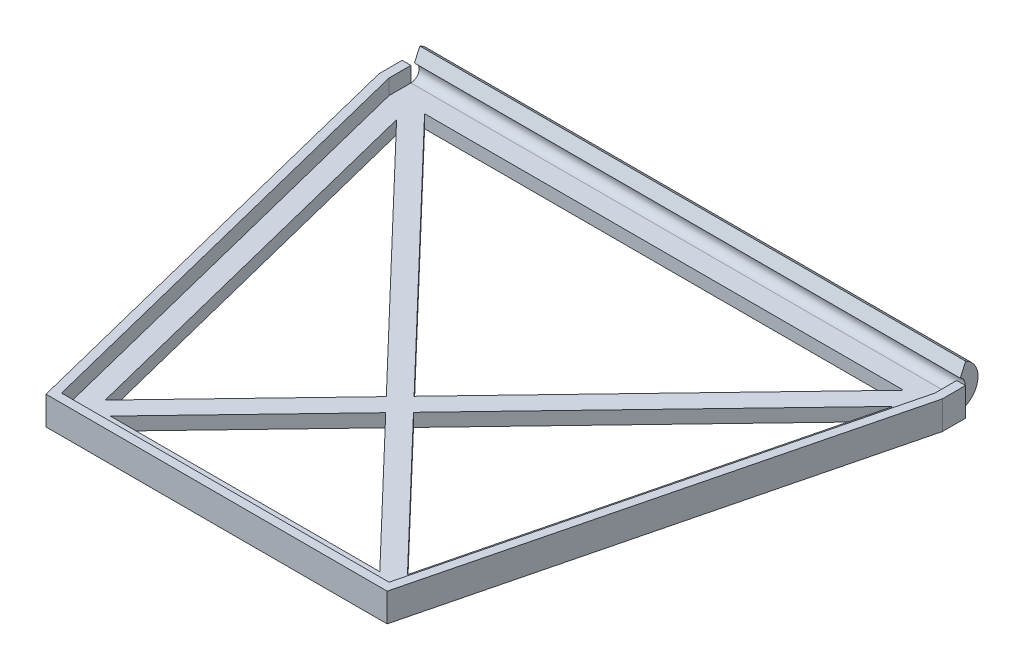
from build123d import *

# Parameters (mm, degrees)
EXTRUDE_THIN1_DEPTH = 1.2
EXTRUDE_THIN2_DEPTH = 1.2
BOSS_EXTRUDE1_DEPTH = 50.02
EXTRUDE_THIN5_START = -2.6
EXTRUDE_THIN5_DEPTH = 2.6


# Read off the part's stored shape, not the designer's step: Extrude-Thin1
with BuildPart() as part:
    # Extrude-Thin1 outline → Extrude-Thin1 (new body)
    with BuildSketch(Plane(origin=(0, 0, 0), x_dir=(1, 0, 0), z_dir=(0, 1, 0))):
        Polygon((-25.01, 39.998768944), (-15.007807764, -0.01), (15.007807764, -0.01), (25.01, 39.998768944), (25.01, 42.01), (-25.01, 42.01), align=None)
        Polygon((13.594602468, 1.8), (-13.594602468, 1.8), (-23.194602468, 40.2), (23.194602468, 40.2), align=None, mode=Mode.SUBTRACT)
    extrude(amount=EXTRUDE_THIN1_DEPTH)

    # Sketch3 → Extrude-Thin2 (add)
    with BuildSketch(Plane.XZ):
        Polygon((23.844483111, -39.577380413), (-12.944721826, -1.177380413), (-14.244483111, -2.422619587), (22.544721826, -40.822619587), align=None)
        Polygon((-22.544721826, -40.822619587), (14.244483111, -2.422619587), (12.944721826, -1.177380413), (-23.844483111, -39.577380413), align=None)
    extrude(amount=-EXTRUDE_THIN2_DEPTH)

    # Sketch4 → Boss-Extrude1 (add)
    with BuildSketch(Plane.ZY.offset(25.01)):
        with BuildLine():
            Line((-42.326963696, 2.62973084), (-42.83410561, 3.717300185))
            ThreePointArc((-42.83410561, 3.717300185), (-43.913777214, 1.527942753), (-42.01, 0))
            Line((-42.01, 0), (-42.01, 1.2))
            ThreePointArc((-42.01, 1.2), (-42.742222005, 1.78767029), (-42.326963696, 2.62973084))
        make_face()
    extrude(amount=-BOSS_EXTRUDE1_DEPTH)

    # Sketch5 → Extrude-Thin5 (add)
    with BuildSketch(Plane.XZ.offset(EXTRUDE_THIN5_START)):
        Polygon((25.01, -42.01), (25.01, -39.998768944), (15.007807764, 0.01), (-15.007807764, 0.01), (-25.01, -39.998768944), (-25.01, -42.01), (-25.81, -42.01), (-25.81, -39.900284443), (-15.632428889, 0.81), (15.632428889, 0.81), (25.81, -39.900284443), (25.81, -42.01), align=None)
    extrude(amount=EXTRUDE_THIN5_DEPTH)


solid = part.part
